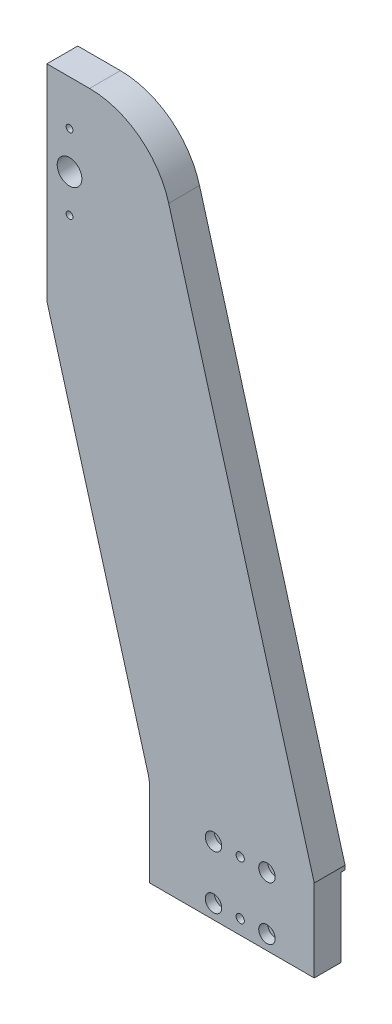
from build123d import *

# Parameters (mm, degrees)
SALIENTE_EXTRUIR1_DEPTH                              = 15
CROQUIS2_R                                           = 6
CORTAR_EXTRUIR1_DEPTH                                = 331.189339622
PERFORADOR_PARA_ROSCAR_PARA_MACHO_DE_ROS_D           = 3.3
PERFORADOR_PARA_ROSCAR_PARA_MACHO_DE_ROS_DEPTH       = 7
PERFORADOR_PARA_ROSCAR_PARA_MACHO_DE_ROS_TIP         = 0.991420021
CROQUIS9_W                                           = 80
CROQUIS9_H                                           = 38
CORTAR_EXTRUIR2_DEPTH                                = 2
PERFORADOR_PARA_ROSCAR_PARA_MACHO_DE_2_D             = 3.3
PERFORADOR_PARA_ROSCAR_PARA_MACHO_DE_2_DEPTH         = 15
PERFORADOR_PARA_ROSCAR_PARA_MACHO_DE_2_TIP           = 0.991420021
TALADROS_DE_ESPIGA_DE_4_0MM1_D                       = 4
TALADROS_DE_ESPIGA_DE_4_0MM1_DEPTH                   = 17
TALADROS_DE_ESPIGA_DE_4_0MM1_TIP                     = 1.201721238
TALADROS_DE_ESPIGA_DE_4_0MM3_D                       = 4
REFRENTADO_PARA_TORNILLO_CON_CABEZA_HUEC_D           = 4.5
REFRENTADO_PARA_TORNILLO_CON_CABEZA_HUEC_CBORE_D     = 8
REFRENTADO_PARA_TORNILLO_CON_CABEZA_HUEC_CBORE_DEPTH = 4.4


with BuildPart() as part:
    # Croquis1 → Saliente-Extruir1 (new body)
    with BuildSketch(Plane.XY):
        with BuildLine():
            Line((80, 0), (80, 40))
            Line((80, 40), (9.228509485, 290.860669242))
            ThreePointArc((9.228509485, 290.860669242), (-5.12786552, 311.893782856), (-29.268839302, 320))
            Line((-29.268839302, 320), (-50, 320))
            Line((-50, 320), (-50, 220))
            Line((-50, 220), (-0.751325607, 45.430334621))
            ThreePointArc((-0.751325607, 45.430334621), (-0.1887218, 42.741031935), (0, 40))
            Line((0, 40), (0, 0))
            Line((0, 0), (80, 0))
        make_face()
    extrude(amount=SALIENTE_EXTRUIR1_DEPTH)

    # Croquis2 → Cortar-Extruir1 (cut, through all)
    with BuildSketch(Plane(origin=(0, 0, 0), x_dir=(-1, 0, 0), z_dir=(0, 0, -1))):
        with Locations((39, 280)):
            Circle(CROQUIS2_R)
    extrude(amount=-CORTAR_EXTRUIR1_DEPTH, mode=Mode.SUBTRACT)

    # Perforador para roscar para macho de ros
    with Locations(Plane.XY.offset(15)):
        with Locations((-39, 298.25), (-39, 261.75)):
            Hole(PERFORADOR_PARA_ROSCAR_PARA_MACHO_DE_ROS_D / 2, depth=PERFORADOR_PARA_ROSCAR_PARA_MACHO_DE_ROS_DEPTH)
            with Locations((0, 0, -(PERFORADOR_PARA_ROSCAR_PARA_MACHO_DE_ROS_DEPTH + PERFORADOR_PARA_ROSCAR_PARA_MACHO_DE_ROS_TIP / 2))):  # 118° drill point
                Cone(0, PERFORADOR_PARA_ROSCAR_PARA_MACHO_DE_ROS_D / 2, PERFORADOR_PARA_ROSCAR_PARA_MACHO_DE_ROS_TIP, mode=Mode.SUBTRACT)

    # Croquis9 → Cortar-Extruir2 (cut)
    with BuildSketch(Plane(origin=(0, 0, 0), x_dir=(-1, 0, 0), z_dir=(0, 0, -1))):
        with Locations((-40, 19)):
            Rectangle(CROQUIS9_W, CROQUIS9_H)
    extrude(amount=-CORTAR_EXTRUIR2_DEPTH, mode=Mode.SUBTRACT)

    # Perforador para roscar para macho de 2
    with Locations(Plane.ZY.offset(50)):
        with Locations((9, 305), (9, 255)):
            Hole(PERFORADOR_PARA_ROSCAR_PARA_MACHO_DE_2_D / 2, depth=PERFORADOR_PARA_ROSCAR_PARA_MACHO_DE_2_DEPTH)
            with Locations((0, 0, -(PERFORADOR_PARA_ROSCAR_PARA_MACHO_DE_2_DEPTH + PERFORADOR_PARA_ROSCAR_PARA_MACHO_DE_2_TIP / 2))):  # 118° drill point
                Cone(0, PERFORADOR_PARA_ROSCAR_PARA_MACHO_DE_2_D / 2, PERFORADOR_PARA_ROSCAR_PARA_MACHO_DE_2_TIP, mode=Mode.SUBTRACT)

    # Taladros de espiga de Ø4.0mm1
    with Locations(Plane.ZY.offset(50)):
        with Locations((9, 294), (9, 266)):
            Hole(TALADROS_DE_ESPIGA_DE_4_0MM1_D / 2, depth=TALADROS_DE_ESPIGA_DE_4_0MM1_DEPTH)
            with Locations((0, 0, -(TALADROS_DE_ESPIGA_DE_4_0MM1_DEPTH + TALADROS_DE_ESPIGA_DE_4_0MM1_TIP / 2))):  # 118° drill point
                Cone(0, TALADROS_DE_ESPIGA_DE_4_0MM1_D / 2, TALADROS_DE_ESPIGA_DE_4_0MM1_TIP, mode=Mode.SUBTRACT)

    # Taladros de espiga de Ø4.0mm3 (through all)
    with Locations(Plane.XY.offset(15)):
        with Locations((44, 33), (44, 7)):
            Hole(TALADROS_DE_ESPIGA_DE_4_0MM3_D / 2)

    # Refrentado para tornillo con cabeza hueca de M41 (through all)
    with Locations(Plane.XY.offset(15)):
        with Locations((57, 33), (31, 7), (31, 33), (57, 7)):
            CounterBoreHole(REFRENTADO_PARA_TORNILLO_CON_CABEZA_HUEC_D / 2, REFRENTADO_PARA_TORNILLO_CON_CABEZA_HUEC_CBORE_D / 2, REFRENTADO_PARA_TORNILLO_CON_CABEZA_HUEC_CBORE_DEPTH)


solid = part.part
